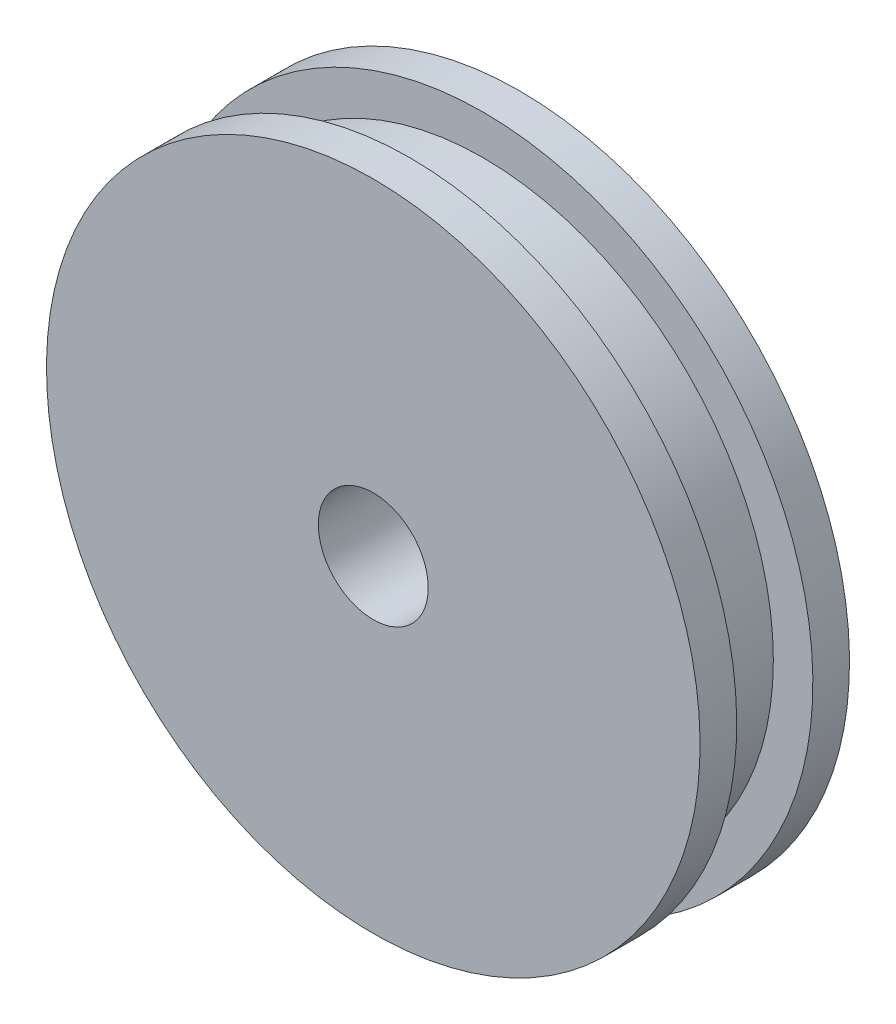
from build123d import *


with BuildPart() as part:
    # Эскиз1 → Повернуть1 (revolve)
    with BuildSketch(Plane.XZ):
        Polygon((7.920821781, 1), (7.920821781, 3), (8.920821781, 3), (8.920821781, 4), (1.5, 4), (1.5, 0), (9, 0), (9, 1), align=None)
    revolve(axis=Axis((0, 0, 4), (0, 0, -1)))


solid = part.part
